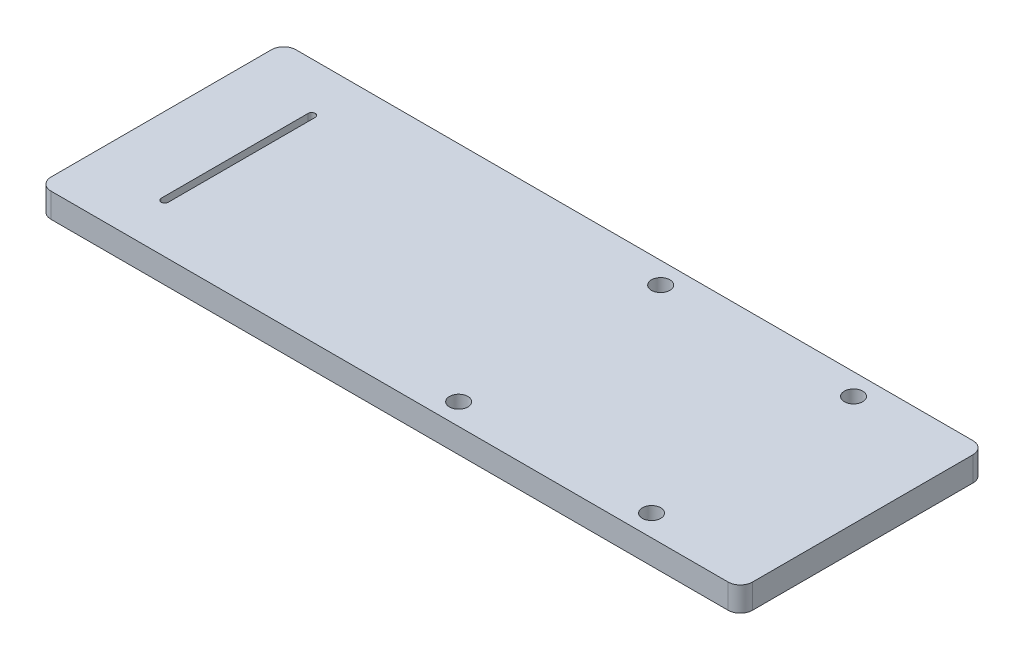
from build123d import *

# Parameters (mm, degrees)
SKETCH1_W           = 363.80000011
SKETCH1_H           = 127
BOSS_EXTRUDE1_DEPTH = 12.7
FILLET1_R           = 6.35
SKETCH2_R           = 4.7752
CUT_EXTRUDE1_DEPTH  = 194.083272243
CUT_EXTRUDE2_REACH  = 195.083


with BuildPart() as part:
    # Sketch1 → Boss-Extrude1 (new body)
    with BuildSketch(Plane(origin=(0, 0, 0), x_dir=(1, 0, 0), z_dir=(0, 1, 0))):
        Rectangle(SKETCH1_W, SKETCH1_H)
    extrude(amount=BOSS_EXTRUDE1_DEPTH)

    # Fillet1
    fillet1_edges = [part.edges().sort_by_distance(p)[0] for p in [
        (-181.900000055, 6.35, -63.5),
        (181.900000055, 6.35, -63.5),
        (181.900000055, 6.35, 63.5),
        (-181.900000055, 6.35, 63.5),
    ]]
    fillet(fillet1_edges, radius=FILLET1_R)

    # Sketch2 → Cut-Extrude1 (cut, through all)
    with BuildSketch(Plane(origin=(0, 12.7, 0), x_dir=(1, 0, 0), z_dir=(0, 1, 0))):
        with Locations((24.729999943, 52.3748)):
            Circle(SKETCH2_R)
        with Locations((24.729999943, -52.3748)):
            Circle(SKETCH2_R)
        with Locations((124.750000055, -52.3748)):
            Circle(SKETCH2_R)
        with Locations((124.750000055, 52.3748)):
            Circle(SKETCH2_R)
    extrude(amount=-CUT_EXTRUDE1_DEPTH, mode=Mode.SUBTRACT)

    # Sketch3 → Cut-Extrude2 (cut, up to next)
    with BuildSketch(Plane.XZ, mode=Mode.PRIVATE) as cut_extrude2_sk1:
        with BuildLine():
            Line((-140.146421401, 38.1), (-140.146421401, -38.1))
            ThreePointArc((-140.146421401, -38.1), (-141.975278712, -39.928857312), (-143.804136024, -38.1))
            Line((-143.804136024, -38.1), (-143.804136024, 38.1))
            ThreePointArc((-143.804136024, 38.1), (-141.975278712, 39.928857312), (-140.146421401, 38.1))
        make_face()
    cut_extrude2_tool1 = extrude(cut_extrude2_sk1.sketch, amount=-CUT_EXTRUDE2_REACH, mode=Mode.PRIVATE) & part.part
    add(cut_extrude2_tool1.solids().sort_by_distance((-141.975279, 0, 0))[0], mode=Mode.SUBTRACT)


solid = part.part
